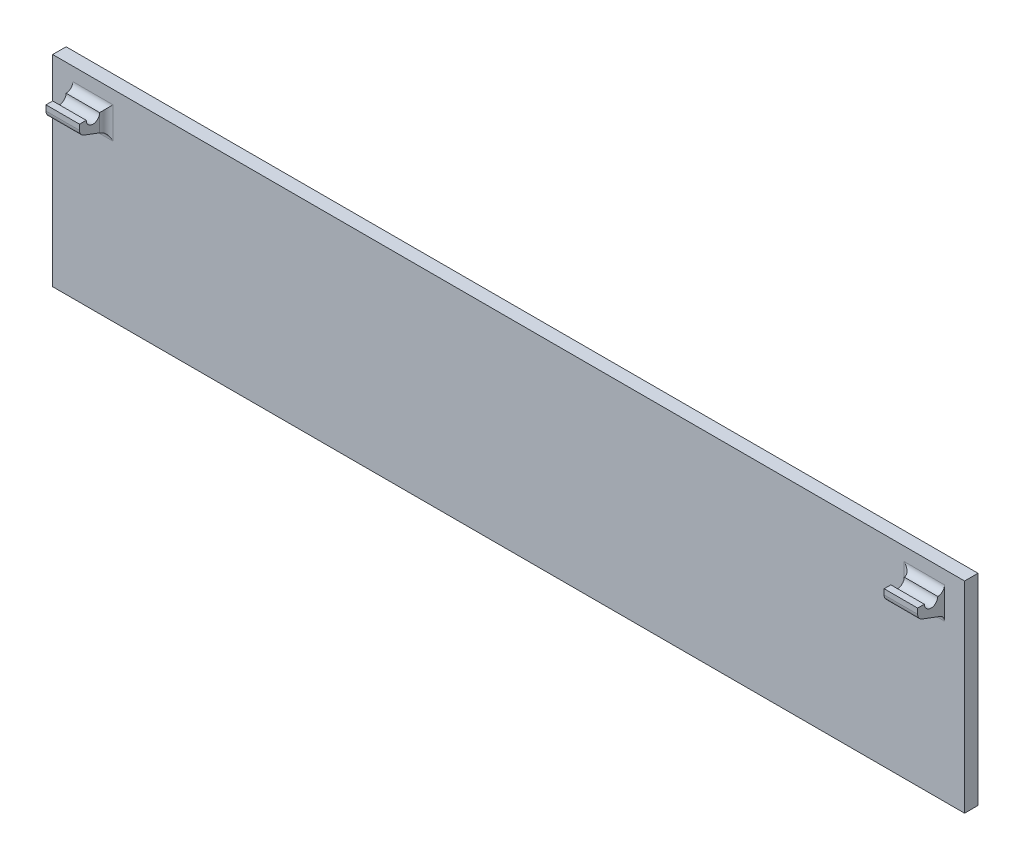
from build123d import *

# Parameters (mm, degrees)
SKETCH1_W                                     = 680
SKETCH1_H                                     = 150
VERTICAL_PORTION_DEPTH                        = 10
SHAFT_ADAPTER_RIGHT_DEPTH                     = 25
SHAFT_ADAPTER_FILLETS_R                       = 5
SKETCH5_W                                     = 100
SKETCH5_H                                     = 5
LIMIT_TAB_PREVENTS_GATE_FROM_GETTING_PU_DEPTH = 10
LIMIT_TAB_FILLETS_R                           = 5


with BuildPart() as part:
    # Sketch1 → Vertical portion (new body)
    with BuildSketch(Plane.XY):
        Rectangle(SKETCH1_W, SKETCH1_H)
    extrude(amount=VERTICAL_PORTION_DEPTH)

    # Sketch4 → Shaft adapter right (add)
    with BuildSketch(Plane(origin=(325, 0, 0), x_dir=(0, 0, -1), z_dir=(1, 0, 0))):
        with BuildLine():
            Line((-10, 45), (-30, 52.5))
            Line((-30, 52.5), (-30, 60))
            Line((-30, 60), (-25, 60))
            ThreePointArc((-25, 60), (-20, 55), (-15, 60))
            Line((-15, 60), (-10, 60))
            Line((-10, 60), (-10, 55))
            Line((-10, 55), (-10, 45))
        make_face()
    shaft_adapter_right = extrude(amount=-SHAFT_ADAPTER_RIGHT_DEPTH)

    # Shaft adapter left: Shaft adapter right across plane
    add(shaft_adapter_right.mirror(Plane(origin=(0, 0, 0), x_dir=(0, 0, 1), z_dir=(1, 0, 0))))

    # Shaft adapter fillets
    shaft_adapter_fillets_edges = [part.edges().sort_by_distance(p)[0] for p in [
        (-312.5, 52.5, 30),
        (312.5, 52.5, 30),
        (300, 52.5, 10),
        (-300, 52.5, 10),
        (-312.5, 45, 10),
        (312.5, 45, 10),
        (312.5, 60, 10),
        (-312.5, 60, 10),
    ]]
    fillet(shaft_adapter_fillets_edges, radius=SHAFT_ADAPTER_FILLETS_R - 0.0001)  # a hair under: the kernel refuses the full size

    # Sketch5 → Limit tab (prevents gate from getting pushed out of slot) (add)
    with BuildSketch(Plane(origin=(0, 0, 0), x_dir=(-1, 0, 0), z_dir=(0, 0, -1))):
        with Locations((-100, -72.5)):
            Rectangle(SKETCH5_W, SKETCH5_H)
        with Locations((100, -72.5)):
            Rectangle(SKETCH5_W, SKETCH5_H)
    extrude(amount=LIMIT_TAB_PREVENTS_GATE_FROM_GETTING_PU_DEPTH)

    # Limit tab fillets
    limit_tab_fillets_edges = [part.edges().sort_by_distance(p)[0] for p in [
        (150, -72.5, 0),
        (50, -72.5, 0),
        (100, -70, 0),
        (-150, -72.5, 0),
        (-100, -70, 0),
        (-50, -72.5, 0),
    ]]
    fillet(limit_tab_fillets_edges, radius=LIMIT_TAB_FILLETS_R)


solid = part.part
